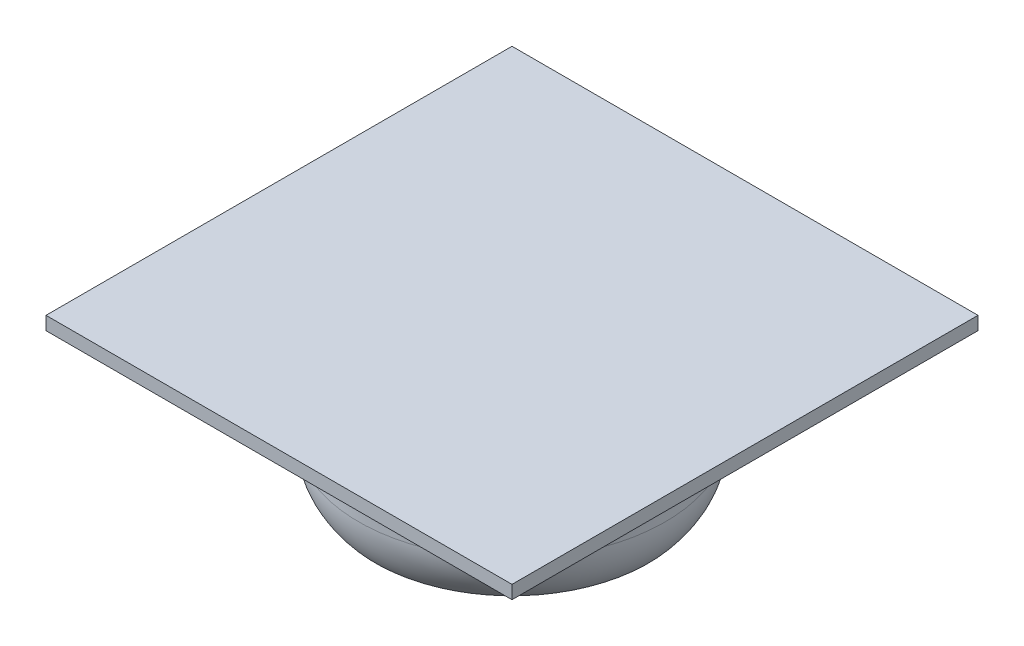
from build123d import *

# Parameters (mm, degrees)
SKETCH1_W           = 35
SKETCH1_H           = 35
BOSS_EXTRUDE1_DEPTH = 1
SKETCH3_R           = 11.5
SKETCH3_R_2         = 10.25
BOSS_EXTRUDE3_DEPTH = 10
FILLET1_R           = 5


with BuildPart() as part:
    # Sketch1 → Boss-Extrude1 (new body)
    with BuildSketch(Plane(origin=(0, 0, 0), x_dir=(1, 0, 0), z_dir=(0, 1, 0))):
        with Locations((17.5, 17.5)):
            Rectangle(SKETCH1_W, SKETCH1_H)
    extrude(amount=BOSS_EXTRUDE1_DEPTH)

    # Sketch3 → Boss-Extrude3 (add)
    with BuildSketch(Plane.XZ):
        with Locations(Location((17.5, -17.5, 0), (0, 0, 270))):
            Circle(SKETCH3_R)
        with Locations(Location((17.5, -17.5, 0), (0, 0, 270))):
            Circle(SKETCH3_R_2, mode=Mode.SUBTRACT)
    extrude(amount=BOSS_EXTRUDE3_DEPTH)

    # Fillet1
    # the kernel refuses this fillet: 5 mm, written as the material it takes off along each edge
    with BuildSketch(Plane(origin=(17.5, -10, -17.5), x_dir=(0, 0, -1), z_dir=(-1, 0, 0))) as fillet1_piece_1:
        with BuildLine():
            CenterArc((6.5, -3.307189139), FILLET1_R, 0, 41.409622109)
            Line((10.25, 0), (10.325, 0.066143783))
            ThreePointArc((10.325, 0.066143783), (10.875, 0.1), (11.5, 0.1))
            Line((11.5, 0.1), (11.6, 0))
            Line((11.6, 0), (11.6, -3.307189139))
            Line((11.6, -3.307189139), (11.5, -3.307189139))
        make_face()
    revolve(axis=Axis((17.5, -10, -17.5), (0, -1, 0)), mode=Mode.SUBTRACT)


solid = part.part
